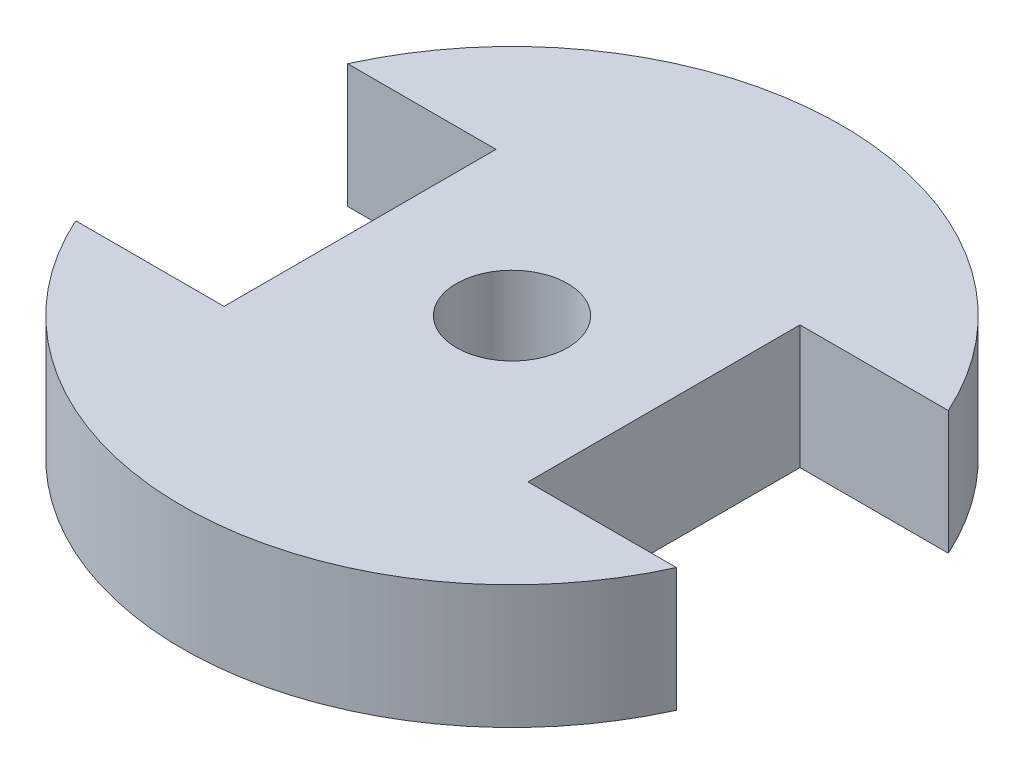
from build123d import *

# Parameters (mm, degrees)
SKETCH1_R           = 2.25
BOSS_EXTRUDE1_DEPTH = 5


with BuildPart() as part:
    # Sketch1 → Boss-Extrude1 (new body)
    with BuildSketch(Plane(origin=(0, 0, 0), x_dir=(1, 0, 0), z_dir=(0, 1, 0))):
        with BuildLine():
            Line((-12.147930894, 5.5), (-6.147930894, 5.5))
            Line((-6.147930894, 5.5), (-6.147930894, -5.5))
            Line((-6.147930894, -5.5), (-12.147930894, -5.5))
            ThreePointArc((-12.147930894, -5.5), (0, -13.335), (12.147930894, -5.5))
            Line((12.147930894, -5.5), (6.147930894, -5.5))
            Line((6.147930894, -5.5), (6.147930894, 5.5))
            Line((6.147930894, 5.5), (12.147930894, 5.5))
            ThreePointArc((12.147930894, 5.5), (0, 13.335), (-12.147930894, 5.5))
        make_face()
        Circle(SKETCH1_R, mode=Mode.SUBTRACT)
    extrude(amount=BOSS_EXTRUDE1_DEPTH)


solid = part.part
